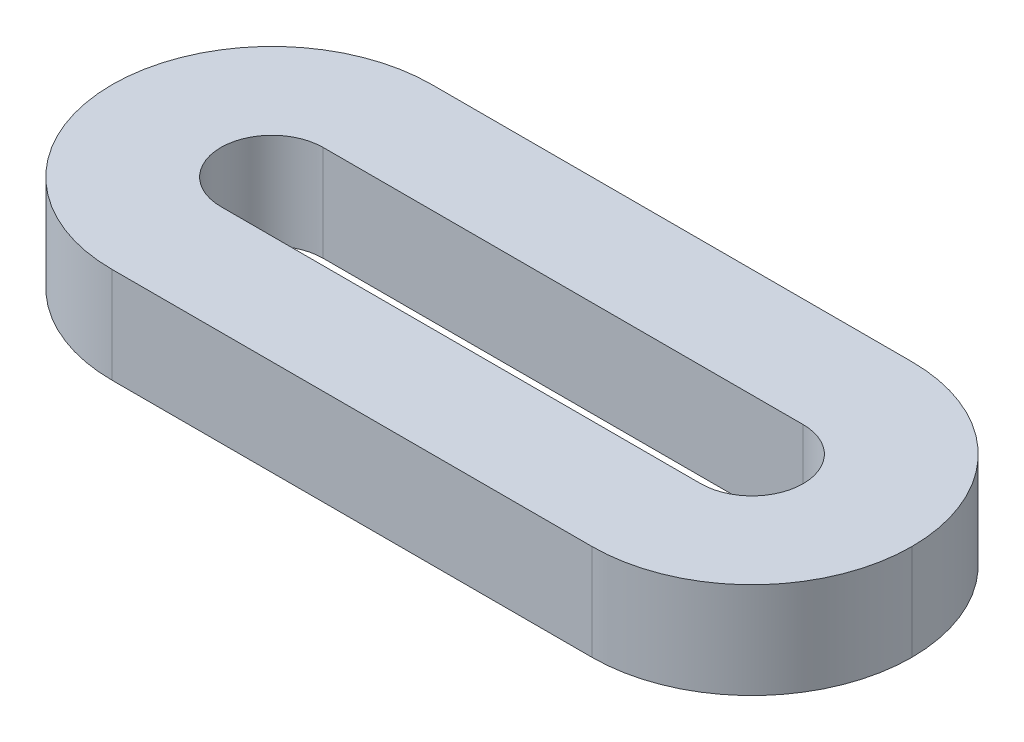
from build123d import *

# Parameters (mm, degrees)
SKETCH_1_W      = 25
SKETCH_1_H      = 10
EXTRUDE_1_DEPTH = 3
FILLET_1_R      = 5


with BuildPart() as part:
    # 草图1 → 凸台-拉伸1 (new body)
    with BuildSketch(Plane(origin=(0, 0, 0), x_dir=(1, 0, 0), z_dir=(0, 1, 0))):
        with Locations((-7.5, 0)):
            Rectangle(SKETCH_1_W, SKETCH_1_H)
        with BuildLine():
            Line((0, -1.6), (-15, -1.6))
            ThreePointArc((-15, -1.6), (-16.6, 0), (-15, 1.6))
            Line((-15, 1.6), (0, 1.6))
            ThreePointArc((0, 1.6), (1.6, 0), (0, -1.6))
        make_face(mode=Mode.SUBTRACT)
    extrude(amount=EXTRUDE_1_DEPTH)

    # 圆角1
    fillet_1_edges = [part.edges().sort_by_distance(p)[0] for p in [
        (5, 1.5, 5),
        (5, 1.5, -5),
        (-20, 1.5, -5),
        (-20, 1.5, 5),
    ]]
    fillet(fillet_1_edges, radius=FILLET_1_R - 0.0001)  # a hair under: the kernel refuses the full size


solid = part.part
